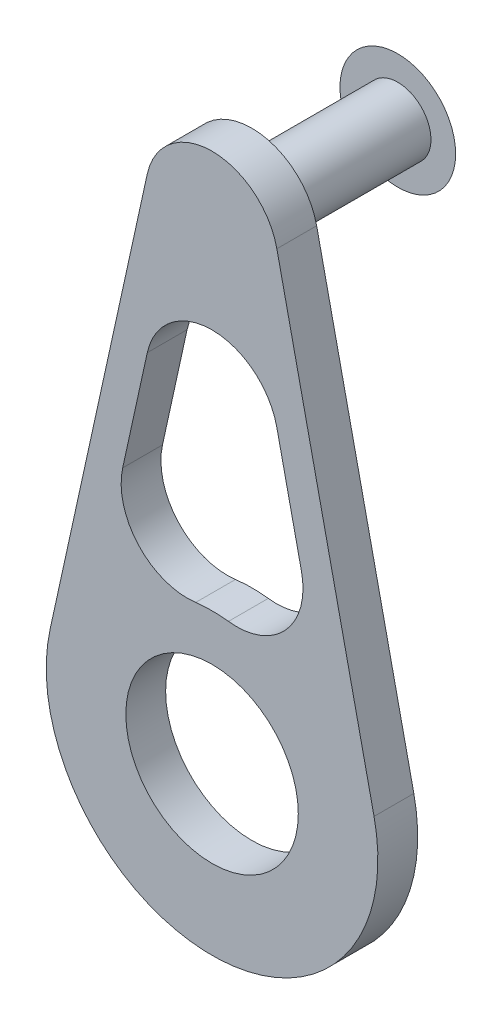
from build123d import *

# Parameters (mm, degrees)
SKETCH_1_R      = 2.5
EXTRUDE_1_DEPTH = 11
EXTRUDE_2_DEPTH = 3
EXTRUDE_START   = -3
SKETCH_4_R      = 10
SKETCH_4_R_2    = 6.5
EXTRUDE_3_DEPTH = 3
FILLET_START    = 11
FILLET_1_DEPTH  = 3


with BuildPart() as part:
    # 草图1 → 凸台-拉伸1 (new body)
    with BuildSketch(Plane.XY):
        Circle(SKETCH_1_R)
    extrude(amount=EXTRUDE_1_DEPTH)

    # 草图2 → 旋转1 (revolve)
    with BuildSketch(Plane(origin=(0, 0, 0), x_dir=(1, 0, 0), z_dir=(0, 1, 0))):
        with BuildLine():
            Line((0, 0), (-4.358898944, 0))
            ThreePointArc((-4.358898944, 0), (-2.236067977, 0.746794345), (0, 1))
            Line((0, 1), (0, 0))
        make_face()
    revolve(axis=Axis((0, 0, 0), (0, 0, -1)))

    # 草图3 → 凸台-拉伸2 (add)
    with BuildSketch(Plane.XY.offset(11)):
        with BuildLine():
            Line((-4.883855118, 1.071428571), (-12.209637796, -32.321428571))
            ThreePointArc((-12.209637796, -32.321428571), (0, -47.5), (12.209637796, -32.321428571))
            Line((12.209637796, -32.321428571), (4.883855118, 1.071428571))
            ThreePointArc((4.883855118, 1.071428571), (0, 5), (-4.883855118, 1.071428571))
        make_face()
        with BuildLine():
            Line((-9.767710237, -32.857142857), (-4.883855118, -10.595238095))
            ThreePointArc((-4.883855118, -10.595238095), (0, -6.666666667), (4.883855118, -10.595238095))
            Line((4.883855118, -10.595238095), (9.767710237, -32.857142857))
            ThreePointArc((9.767710237, -32.857142857), (0, -45), (-9.767710237, -32.857142857))
        make_face(mode=Mode.SUBTRACT)
    extrude(amount=EXTRUDE_2_DEPTH)

    # 草图4 → 凸台-拉伸3 (add)
    with BuildSketch(Plane.XY.offset(14).offset(EXTRUDE_START)):
        with Locations((0, -35)):
            Circle(SKETCH_4_R)
        with Locations((0, -35)):
            Circle(SKETCH_4_R_2, mode=Mode.SUBTRACT)
    extrude(amount=EXTRUDE_3_DEPTH)

    # 圆角1: read off the stored shape, not the designer's step
    # 圆角1 outline → 圆角1 (add)
    with BuildSketch(Plane.XY.offset(FILLET_START)):
        with BuildLine():
            ThreePointArc((6.737252603, -19.043514567), (5.547910317, -23.48400457), (1.235598323, -25.076628759))
            ThreePointArc((1.235598323, -25.076628759), (6.738122863, -27.610974335), (9.767710237, -32.857142857))
            Line((9.767710237, -32.857142857), (6.737252603, -19.043514567))
        make_face()
        with BuildLine():
            ThreePointArc((-9.767710237, -32.857142857), (-6.738122863, -27.610974335), (-1.235598323, -25.076628759))
            ThreePointArc((-1.235598323, -25.076628759), (-5.547910317, -23.48400457), (-6.737252603, -19.043514567))
            Line((-6.737252603, -19.043514567), (-9.767710237, -32.857142857))
        make_face()
    extrude(amount=FILLET_1_DEPTH)


solid = part.part
